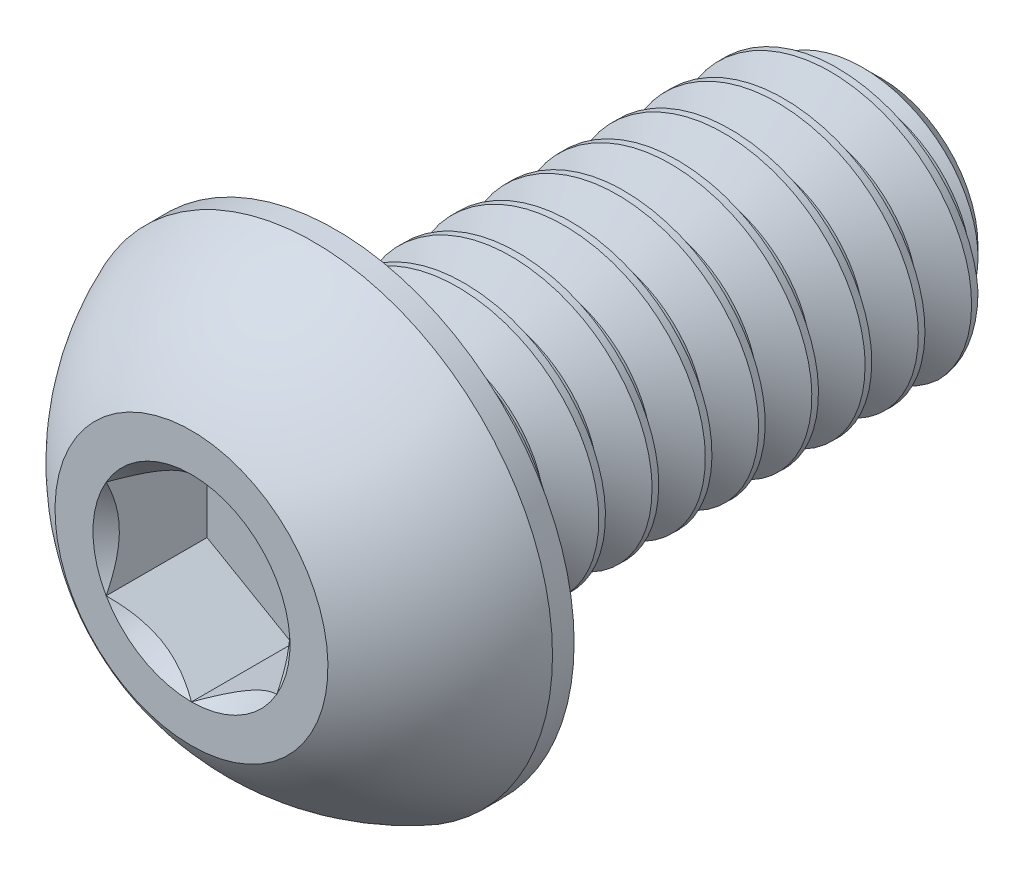
from build123d import *

# Parameters (mm, degrees)
SKETCH1_W          = 12.7
SKETCH1_H          = 3.175
CHAMFER1_SIZE      = 0.929268293
CUT_SWEEP1_PITCH   = 1.23902439
CUT_EXTRUDE2_DEPTH = 2.34696


with BuildPart() as part:
    # Sketch1 → Revolve1 (revolve)
    with BuildSketch(Plane(origin=(0, 0, 0), x_dir=(0, 0, -1), z_dir=(1, 0, 0))):
        with Locations((9.7028, 1.5875)):
            Rectangle(SKETCH1_W, SKETCH1_H)
    revolve(axis=Axis((0, 0, -16.0528), (0, 0, 1)))

    # Chamfer1
    chamfer1_edges = [part.edges().sort_by_distance(p)[0] for p in [
        (0, -3.175, -16.0528),
    ]]
    chamfer(chamfer1_edges, length=CHAMFER1_SIZE)

    # Cut-Sweep1: the profile of Sketch2 profile screwed along a right-hand helix of 12.956 turns, 8 arcs to a turn; built about Z, then put on its axis
    cut_sweep1_z = Axis((0, 0, 0), (0, 0, 1))
    cut_sweep1_corners = [(3.1753, 0, 0.000173205), (3.1753, 0, -1.084319547), (2.370230052, 0, -0.619512195), (2.370230052, 0, -0.464634146)]
    with BuildLine(mode=Mode.PRIVATE) as cut_sweep1_profile:
        Line(cut_sweep1_corners[0], cut_sweep1_corners[1])
        Line(cut_sweep1_corners[1], cut_sweep1_corners[2])
        Line(cut_sweep1_corners[2], cut_sweep1_corners[3])
        Line(cut_sweep1_corners[3], cut_sweep1_corners[0])
    cut_sweep1_cap = Face(cut_sweep1_profile.wire())
    cut_sweep1_turn_angles = [0, 22.5, 45, 67.5, 90, 112.5, 135, 157.5, 180, 202.5, 225, 247.5, 270, 292.5, 315, 337.5, 360]
    cut_sweep1_turn_weights = [1, 0.9238795325112867, 1, 0.9238795325112867, 1, 0.9238795325112867, 1, 0.9238795325112867, 1, 0.9238795325112867, 1, 0.9238795325112867, 1, 0.9238795325112867, 1, 0.9238795325112867, 1]
    cut_sweep1_turn_rails = [Edge.make_bspline([Vector(p[0], p[1], 0).rotate(cut_sweep1_z, cut_sweep1_turn_angles[k]) / cut_sweep1_turn_weights[k] + Vector(0, 0, p[2] + CUT_SWEEP1_PITCH * cut_sweep1_turn_angles[k] / 360) for k in range(17)], [0, 0, 0, 1, 1, 2, 2, 3, 3, 4, 4, 5, 5, 6, 6, 7, 7, 8, 8, 8], 2, cut_sweep1_turn_weights) for p in cut_sweep1_corners]
    cut_sweep1_turn_sides = [Face.make_surface_from_curves(cut_sweep1_turn_rails[p[0]], cut_sweep1_turn_rails[p[1]]) for p in [(0, 1), (1, 2), (2, 3), (3, 0)]]
    cut_sweep1_last_angles = [4320, 4342.5, 4365, 4387.5, 4410, 4432.5, 4455, 4477.5, 4500, 4522.5, 4545, 4567.5, 4590, 4612.5, 4635, 4649.58, 4664.16]
    cut_sweep1_last_weights = [1, 0.9238795325112867, 1, 0.9238795325112867, 1, 0.9238795325112867, 1, 0.9238795325112867, 1, 0.9238795325112867, 1, 0.9238795325112867, 1, 0.9238795325112867, 1, 0.9677971003289138, 1]
    cut_sweep1_last_rails = [Edge.make_bspline([Vector(p[0], p[1], 0).rotate(cut_sweep1_z, cut_sweep1_last_angles[k]) / cut_sweep1_last_weights[k] + Vector(0, 0, p[2] + CUT_SWEEP1_PITCH * cut_sweep1_last_angles[k] / 360) for k in range(17)], [0, 0, 0, 1, 1, 2, 2, 3, 3, 4, 4, 5, 5, 6, 6, 7, 7, 8, 8, 8], 2, cut_sweep1_last_weights) for p in cut_sweep1_corners]
    cut_sweep1_last_sides = [Face.make_surface_from_curves(cut_sweep1_last_rails[p[0]], cut_sweep1_last_rails[p[1]]) for p in [(0, 1), (1, 2), (2, 3), (3, 0)]]
    cut_sweep1 = Plane(origin=(0, 0, -16.0528), x_dir=(0, 1, 0), z_dir=(0, 0, 1)) * Solid(Shell([*[p.moved(Location((0, 0, CUT_SWEEP1_PITCH * i))) for i in range(12) for p in cut_sweep1_turn_sides], *cut_sweep1_last_sides, cut_sweep1_cap, cut_sweep1_cap.rotate(cut_sweep1_z, 4664.16).moved(Location((0, 0, CUT_SWEEP1_PITCH * 4664.16 / 360)))]))
    add(cut_sweep1, mode=Mode.SUBTRACT)

    # Sketch7 → Revolve2 (revolve)
    with BuildSketch(Plane(origin=(0, 0, 0), x_dir=(0, 0, -1), z_dir=(1, 0, 0)), mode=Mode.PRIVATE) as revolve2_sk:
        with BuildLine():
            Line((2.84988, 5.5499), (3.3528, 5.5499))
            Line((3.3528, 5.5499), (3.3528, 0))
            Line((3.3528, 0), (0, 0))
            Line((0, 0), (0, 3.175))
            ThreePointArc((0, 3.175), (1.235921075, 4.58927271), (2.84988, 5.5499))
        make_face()
    revolve(revolve2_sk.sketch.rotate(Axis((0, 0, 0), (0, 0, -1)), 189.052465709), axis=Axis((0, 0, 0), (0, 0, -1)))

    # Sketch5 → Cut-Extrude2 (cut)
    with BuildSketch(Plane.XY):
        Polygon((1.984375, -1.14567944), (1.984375, 1.14567944), (0, 2.291358881), (-1.984375, 1.14567944), (-1.984375, -1.14567944), (0, -2.291358881), align=None)
    extrude(amount=-CUT_EXTRUDE2_DEPTH, mode=Mode.SUBTRACT)

    # Cut-Extrude3 cone 1 section (through the dimple's axis) → Cut-Extrude3 (revolve, cut)
    with BuildSketch(Plane(origin=(0, 0, 0), x_dir=(0, -1, 0), z_dir=(1, 0, 0))):
        Polygon((0, 0), (2.291358881, 0), (0, 2.291358881), align=None)
    revolve(axis=Axis((0, 0, 0), (0, 0, -1)), mode=Mode.SUBTRACT)


solid = part.part
